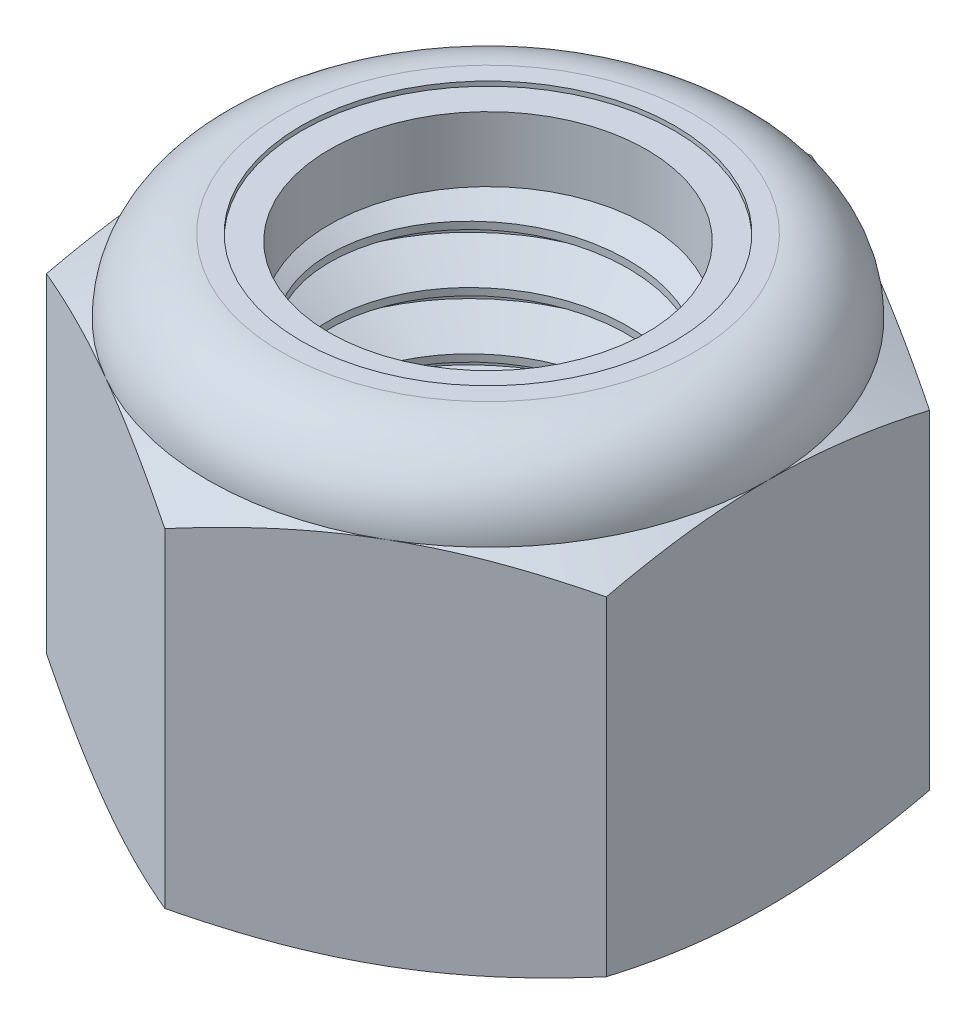
from build123d import *

# Parameters (mm, degrees)
SKETCH1_R        = 6.35
EXTRUDE1_DEPTH   = 15.08125
SKETCH2_W        = 6.35
SKETCH2_H        = 12.567708333
CUT_SWEEP1_PITCH = 1.953846154
SKETCH12_W       = 6.985
SKETCH12_H       = 12.567708333


with BuildPart() as part:
    # Sketch1 → Extrude1 (new body)
    with BuildSketch(Plane(origin=(0, 0, 0), x_dir=(1, 0, 0), z_dir=(0, 1, 0))):
        Polygon((0, 10.998522628), (-9.525, 5.499261314), (-9.525, -5.499261314), (0, -10.998522628), (9.525, -5.499261314), (9.525, 5.499261314), align=None)
        with Locations(Location((0, 0, 0), (0, 0, 90))):
            Circle(SKETCH1_R, mode=Mode.SUBTRACT)
    extrude(amount=EXTRUDE1_DEPTH)

    # Sketch5 → Cut-Revolve3 (revolve, cut)
    with BuildSketch(Plane(origin=(0, 0, 0), x_dir=(0, 0, -1), z_dir=(1, 0, 0))):
        with BuildLine():
            Line((0, 0), (9.525, 0))
            Line((9.525, 0), (10.998522628, 0.687114886))
            Line((10.998522628, 0.687114886), (10.998522628, 11.880593447))
            Line((10.998522628, 11.880593447), (9.525, 12.567708333))
            ThreePointArc((9.525, 12.567708333), (8.788800691, 14.345050691), (7.011458333, 15.08125))
            Line((7.011458333, 15.08125), (7.011458333, 16.35125))
            Line((7.011458333, 16.35125), (12.268522628, 16.35125))
            Line((12.268522628, 16.35125), (12.268522628, -1.27))
            Line((12.268522628, -1.27), (0, -1.27))
            Line((0, -1.27), (0, 0))
        make_face()
    revolve(axis=Axis((0, 0, 0), (0, 1, 0)), mode=Mode.SUBTRACT)

    # Sketch6 → Cut-Revolve4 (revolve, cut)
    with BuildSketch(Plane(origin=(0, 0, 0), x_dir=(0, 0, -1), z_dir=(1, 0, 0))):
        with BuildLine():
            Line((0, 12.567708333), (9.3726, 12.567708333))
            ThreePointArc((9.3726, 12.567708333), (8.681037617, 14.237287617), (7.011458333, 14.92885))
            Line((7.011458333, 14.92885), (3.505729167, 14.92885))
            Line((3.505729167, 14.92885), (3.505729167, 16.35125))
            Line((3.505729167, 16.35125), (0, 16.35125))
            Line((0, 16.35125), (0, 12.567708333))
        make_face()
    revolve(axis=Axis((0, 16.35125, 0), (0, -1, 0)), mode=Mode.SUBTRACT)

    # Sketch4 → Cut-Revolve2 (revolve, cut)
    with BuildSketch(Plane(origin=(0, 0, 0), x_dir=(0, 0, -1), z_dir=(1, 0, 0))):
        Polygon((0, 12.567708333), (6.985, 12.567708333), (0, 9.310549341), align=None)
        Polygon((0, 3.257158992), (6.985, 0), (0, 0), align=None)
    revolve(axis=Axis((0, 0, 0), (0, 1, 0)), mode=Mode.SUBTRACT)

    # Sketch12 → Revolve4 (revolve)
    with BuildSketch(Plane(origin=(0, 0, 0), x_dir=(0, 0, -1), z_dir=(1, 0, 0)), mode=Mode.PRIVATE) as revolve4_sk:
        with Locations((3.4925, 6.283854167)):
            Rectangle(SKETCH12_W, SKETCH12_H)
    revolve(revolve4_sk.sketch.rotate(Axis((0, 0, 0), (0, 1, 0)), 180), axis=Axis((0, 0, 0), (0, 1, 0)))


with BuildPart() as body_2:
    # Sketch7 → Revolve2 (revolve)
    with BuildSketch(Plane(origin=(0, 0, 0), x_dir=(0, 0, -1), z_dir=(1, 0, 0))):
        with BuildLine():
            Line((5.3975, 12.643908333), (9.295129058, 12.643908333))
            ThreePointArc((9.295129058, 12.643908333), (8.599986877, 14.210125907), (7.011458333, 14.85265))
            Line((7.011458333, 14.85265), (5.3975, 14.85265))
            Line((5.3975, 14.85265), (5.3975, 12.643908333))
        make_face()
    revolve(axis=Axis((0, 12.643908333, 0), (0, 1, 0)))


with BuildPart() as body_3:
    # Sketch2 → Revolve1 (revolve)
    with BuildSketch(Plane(origin=(0, 0, 0), x_dir=(0, 0, -1), z_dir=(1, 0, 0)), mode=Mode.PRIVATE) as revolve1_sk:
        with Locations((3.175, 6.283854167)):
            Rectangle(SKETCH2_W, SKETCH2_H)
    revolve(revolve1_sk.sketch.rotate(Axis((0, -6.35, 0), (0, 1, 0)), 180), axis=Axis((0, -6.35, 0), (0, 1, 0)))

    # Cut-Sweep1: the profile of Sketch9 screwed along a right-hand helix of 8.71875 turns, 10 arcs to a turn; built about Z, then put on its axis
    cut_sweep1_z = Axis((0, 0, 0), (0, 0, 1))
    cut_sweep1_corners = [(6.561510051, 0, 0.122115385), (6.455755025, 0, -1.770673077), (5.080939697, 0, -0.976923077), (5.080939697, 0, -0.732692308)]
    with BuildLine(mode=Mode.PRIVATE) as cut_sweep1_profile:
        Line(cut_sweep1_corners[0], cut_sweep1_corners[1])
        Line(cut_sweep1_corners[1], cut_sweep1_corners[2])
        Line(cut_sweep1_corners[2], cut_sweep1_corners[3])
        Line(cut_sweep1_corners[3], cut_sweep1_corners[0])
    cut_sweep1_cap = Face(cut_sweep1_profile.wire())
    cut_sweep1_turn_angles = [0, 18, 36, 54, 72, 90, 108, 126, 144, 162, 180, 198, 216, 234, 252, 270, 288, 306, 324, 342, 360]
    cut_sweep1_turn_weights = [1, 0.9510565162951535, 1, 0.9510565162951535, 1, 0.9510565162951535, 1, 0.9510565162951535, 1, 0.9510565162951535, 1, 0.9510565162951535, 1, 0.9510565162951535, 1, 0.9510565162951535, 1, 0.9510565162951535, 1, 0.9510565162951535, 1]
    cut_sweep1_turn_rails = [Edge.make_bspline([Vector(p[0], p[1], 0).rotate(cut_sweep1_z, cut_sweep1_turn_angles[k]) / cut_sweep1_turn_weights[k] + Vector(0, 0, p[2] + CUT_SWEEP1_PITCH * cut_sweep1_turn_angles[k] / 360) for k in range(21)], [0, 0, 0, 1, 1, 2, 2, 3, 3, 4, 4, 5, 5, 6, 6, 7, 7, 8, 8, 9, 9, 10, 10, 10], 2, cut_sweep1_turn_weights) for p in cut_sweep1_corners]
    cut_sweep1_turn_sides = [Face.make_surface_from_curves(cut_sweep1_turn_rails[p[0]], cut_sweep1_turn_rails[p[1]]) for p in [(0, 1), (1, 2), (2, 3), (3, 0)]]
    cut_sweep1_last_angles = [2880, 2898, 2916, 2934, 2952, 2970, 2988, 3006, 3024, 3042, 3060, 3078, 3096, 3114, 3132, 3135.375, 3138.75]
    cut_sweep1_last_weights = [1, 0.9510565162951535, 1, 0.9510565162951535, 1, 0.9510565162951535, 1, 0.9510565162951535, 1, 0.9510565162951535, 1, 0.9510565162951535, 1, 0.9510565162951535, 1, 0.9982656101847189, 1]
    cut_sweep1_last_rails = [Edge.make_bspline([Vector(p[0], p[1], 0).rotate(cut_sweep1_z, cut_sweep1_last_angles[k]) / cut_sweep1_last_weights[k] + Vector(0, 0, p[2] + CUT_SWEEP1_PITCH * cut_sweep1_last_angles[k] / 360) for k in range(17)], [0, 0, 0, 1, 1, 2, 2, 3, 3, 4, 4, 5, 5, 6, 6, 7, 7, 8, 8, 8], 2, cut_sweep1_last_weights) for p in cut_sweep1_corners]
    cut_sweep1_last_sides = [Face.make_surface_from_curves(cut_sweep1_last_rails[p[0]], cut_sweep1_last_rails[p[1]]) for p in [(0, 1), (1, 2), (2, 3), (3, 0)]]
    cut_sweep1 = Plane(origin=(0, 12.567708333, 0), x_dir=(0, 0, -1), z_dir=(0, -1, 0)) * Solid(Shell([*[p.moved(Location((0, 0, CUT_SWEEP1_PITCH * i))) for i in range(8) for p in cut_sweep1_turn_sides], *cut_sweep1_last_sides, cut_sweep1_cap, cut_sweep1_cap.rotate(cut_sweep1_z, 3138.75).moved(Location((0, 0, CUT_SWEEP1_PITCH * 3138.75 / 360)))]))
    add(cut_sweep1, mode=Mode.SUBTRACT)

    # Sketch11 → Revolve3 (revolve)
    with BuildSketch(Plane(origin=(0, 0, 0), x_dir=(0, 0, -1), z_dir=(1, 0, 0)), mode=Mode.PRIVATE) as revolve3_sk:
        Polygon((0, 0), (6.985, 0), (0, 3.257158992), align=None)
    revolve(revolve3_sk.sketch.rotate(Axis((0, 15.08125, 0), (0, -1, 0)), 56.033597481), axis=Axis((0, 15.08125, 0), (0, -1, 0)))


with BuildPart() as part_1:
    add(part.part)

    # Combine1: cut body 3
    add(body_3.part, mode=Mode.SUBTRACT)


solid = Compound([body_2.part, part_1.part])
